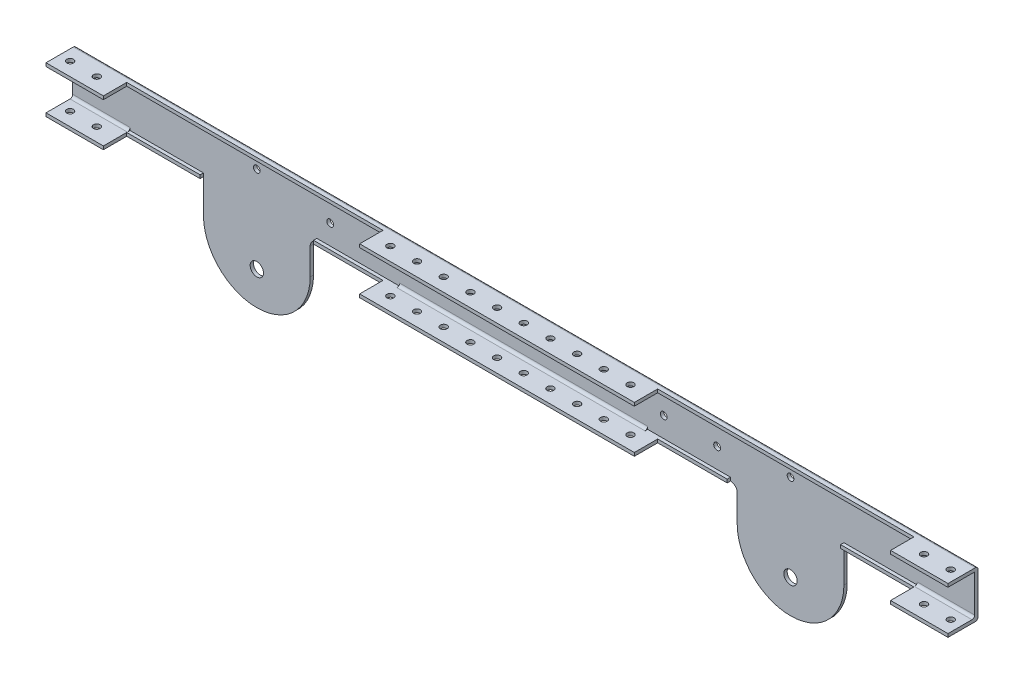
from build123d import *
from build123d.topology import SkipClean

# Parameters (mm, degrees)
SKETCH1_R            = 6.35
BOSS_EXTRUDE1_DEPTH  = 3.175
SKETCH2_W            = 596.9
SKETCH2_H            = 3.175
BOSS_EXTRUDE2_DEPTH  = 25.4
FILLET1_R            = 2.54
SKETCH3_R            = 3.2639
CUT_EXTRUDE1_DEPTH   = 25.4
SKETCH5_R            = 3.2639
CUT_EXTRUDE2_DEPTH   = 25.4
SKETCH6_W            = 31.75
SKETCH6_H            = 44.45
BOSS_EXTRUDE3_DEPTH  = 3.175
SKETCH7_W            = 31.75
SKETCH7_H            = 3.175
SKETCH7_W_2          = 381
BOSS_EXTRUDE4_DEPTH  = 25.4
FILLET2_R            = 2.54
SKETCH8_R            = 3.2639
CUT_EXTRUDE3_DEPTH   = 177.8
SKETCH9_R            = 3.2639
CUT_EXTRUDE5_DEPTH   = 432.308
BOSS_EXTRUDE6_DEPTH  = 66.675
BOSS_EXTRUDE7_START  = 66.675
BOSS_EXTRUDE7_DEPTH  = 66.675
SKETCH12_R           = 6.35
SKETCH12_R_2         = 3.2639
SKETCH12_W           = 256.6289
SKETCH12_H           = 252.715944366
CUT_EXTRUDE8_DEPTH   = 66.675
BOSS_EXTRUDE8_START  = 19.05
BOSS_EXTRUDE8_DEPTH  = 19.05
BOSS_EXTRUDE9_DEPTH  = 19.05
SKETCH16_R           = 3.2639
CUT_EXTRUDE9_DEPTH   = 133.096
SKETCH17_R           = 3.175
CUT_EXTRUDE11_DEPTH  = 5.08
SKETCH18_W           = 256.6289
SKETCH18_H           = 3.175
SKETCH18_W_2         = 838.2
BOSS_EXTRUDE10_DEPTH = 3.175
SKETCH19_W           = 107.950440108
SKETCH19_H           = 6.388661832
SKETCH19_W_2         = 107.95
SKETCH19_H_2         = 3.175
CUT_EXTRUDE12_DEPTH  = 3.175
SKETCH20_W           = 555.272296498
SKETCH20_H           = 244.428342312
SKETCH20_R           = 3.2639
SKETCH20_R_2         = 6.35
SKETCH20_R_3         = 3.175
CUT_EXTRUDE13_DEPTH  = 277.622
BOSS_EXTRUDE11_START = -3.175
SKETCH21_R           = 6.35
BOSS_EXTRUDE11_DEPTH = 3.175
SKETCH22_W           = 47.625
SKETCH22_H           = 22.225
SKETCH22_W_2         = 236.0422
BOSS_EXTRUDE12_DEPTH = 3.175
SKETCH23_W           = 47.625
SKETCH23_H           = 22.225
SKETCH23_W_2         = 236.0422
BOSS_EXTRUDE14_DEPTH = 3.175
BOSS_EXTRUDE15_DEPTH = 12.7
BOSS_EXTRUDE16_START = 12.7
BOSS_EXTRUDE16_DEPTH = 12.7
SKETCH27_R           = 3.175
CUT_EXTRUDE15_DEPTH  = 76.2
SKETCH28_W           = 22.225
SKETCH28_H           = 3.175
BOSS_EXTRUDE17_DEPTH = 12.7
SKETCH29_W           = 22.225
SKETCH29_H           = 3.175
BOSS_EXTRUDE18_DEPTH = 12.7
SKETCH30_R           = 6.321493949
BOSS_EXTRUDE19_DEPTH = 3.175
SKETCH31_R           = 6.35
CUT_EXTRUDE16_DEPTH  = 3.175
SKETCH32_W           = 28.574777667
SKETCH32_H           = 18.699670679
BOSS_EXTRUDE20_DEPTH = 3.175
CUT_EXTRUDE17_START  = -5.715
CUT_EXTRUDE17_DEPTH  = 5.715
CUT_EXTRUDE18_DEPTH  = 5.715


with BuildPart() as part:
    # Sketch1 → Boss-Extrude1 (new body)
    with BuildSketch(Plane.XY):
        with BuildLine():
            Line((50.8, 0), (50.8, 25.4))
            ThreePointArc((50.8, 25.4), (52.659871939, 29.890128061), (57.15, 31.75))
            Line((57.15, 31.75), (438.15, 31.75))
            ThreePointArc((438.15, 31.75), (442.640128061, 29.890128061), (444.5, 25.4))
            Line((444.5, 25.4), (444.5, 0))
            ThreePointArc((444.5, 0), (495.3, -50.8), (546.1, 0))
            Line((546.1, 0), (546.1, 76.2))
            Line((546.1, 76.2), (-50.8, 76.2))
            Line((-50.8, 76.2), (-50.8, 0))
            ThreePointArc((-50.8, 0), (0, -50.8), (50.8, 0))
        make_face()
        Circle(SKETCH1_R, mode=Mode.SUBTRACT)
        with Locations((495.3, 0)):
            Circle(SKETCH1_R, mode=Mode.SUBTRACT)
    extrude(amount=BOSS_EXTRUDE1_DEPTH)

    # Sketch2 → Boss-Extrude2 (add)
    with BuildSketch(Plane.XY.offset(3.175)):
        with Locations((247.65, 74.6125)):
            Rectangle(SKETCH2_W, SKETCH2_H)
    extrude(amount=BOSS_EXTRUDE2_DEPTH)

    # Fillet1
    fillet1_edges = [part.edges().sort_by_distance(p)[0] for p in [
        (247.65, 73.025, 3.175),
        (247.65, 76.2, 0),
    ]]
    fillet(fillet1_edges, radius=FILLET1_R)

    # Sketch3 → Cut-Extrude1 (cut)
    with BuildSketch(Plane(origin=(0, 76.2, 0), x_dir=(1, 0, 0), z_dir=(0, 1, 0))):
        with Locations((527.05, -15.5575)):
            Circle(SKETCH3_R)
        with Locations((501.65, -15.5575)):
            Circle(SKETCH3_R)
        with Locations((476.25, -15.5575)):
            Circle(SKETCH3_R)
        with Locations((450.85, -15.5575)):
            Circle(SKETCH3_R)
        with Locations((425.45, -15.5575)):
            Circle(SKETCH3_R)
        with Locations((400.05, -15.5575)):
            Circle(SKETCH3_R)
        with Locations((374.65, -15.5575)):
            Circle(SKETCH3_R)
        with Locations((349.25, -15.5575)):
            Circle(SKETCH3_R)
        with Locations((323.85, -15.5575)):
            Circle(SKETCH3_R)
        with Locations((298.45, -15.5575)):
            Circle(SKETCH3_R)
        with Locations((273.05, -15.5575)):
            Circle(SKETCH3_R)
        with Locations((247.65, -15.5575)):
            Circle(SKETCH3_R)
        with Locations((222.25, -15.5575)):
            Circle(SKETCH3_R)
        with Locations((196.85, -15.5575)):
            Circle(SKETCH3_R)
        with Locations((171.45, -15.5575)):
            Circle(SKETCH3_R)
        with Locations((146.05, -15.5575)):
            Circle(SKETCH3_R)
        with Locations((120.65, -15.5575)):
            Circle(SKETCH3_R)
        with Locations((95.25, -15.5575)):
            Circle(SKETCH3_R)
        with Locations((69.85, -15.5575)):
            Circle(SKETCH3_R)
        with Locations((44.45, -15.5575)):
            Circle(SKETCH3_R)
        with Locations((19.05, -15.5575)):
            Circle(SKETCH3_R)
        with Locations((-6.35, -15.5575)):
            Circle(SKETCH3_R)
        with Locations((-31.75, -15.5575)):
            Circle(SKETCH3_R)
    extrude(amount=-CUT_EXTRUDE1_DEPTH, mode=Mode.SUBTRACT)

    # Sketch5 → Cut-Extrude2 (cut)
    with BuildSketch(Plane(origin=(0, 0, 0), x_dir=(-1, 0, 0), z_dir=(0, 0, -1))):
        with Locations((-425.45, 53.975)):
            Circle(SKETCH5_R)
        with Locations((-374.65, 53.975)):
            Circle(SKETCH5_R)
        with Locations((-323.85, 53.975)):
            Circle(SKETCH5_R)
        with Locations((-273.05, 53.975)):
            Circle(SKETCH5_R)
        with Locations((-222.25, 53.975)):
            Circle(SKETCH5_R)
        with Locations((-171.45, 53.975)):
            Circle(SKETCH5_R)
        with Locations((-120.65, 53.975)):
            Circle(SKETCH5_R)
        with Locations((-69.85, 53.975)):
            Circle(SKETCH5_R)
    extrude(amount=-CUT_EXTRUDE2_DEPTH, mode=Mode.SUBTRACT)

    # Sketch6 → Boss-Extrude3 (add)
    with BuildSketch(Plane.XY.offset(3.175)):
        with Locations((-66.675, 53.975)):
            Rectangle(SKETCH6_W, SKETCH6_H)
        with Locations((561.975, 53.975)):
            Rectangle(SKETCH6_W, SKETCH6_H)
    extrude(amount=-BOSS_EXTRUDE3_DEPTH)

    # Sketch7 → Boss-Extrude4 (add)
    with BuildSketch(Plane.XY.offset(3.175)):
        with Locations((-66.675, 74.6125)):
            Rectangle(SKETCH7_W, SKETCH7_H)
        with Locations((-66.675, 33.3375)):
            Rectangle(SKETCH7_W, SKETCH7_H)
        with Locations((561.975, 74.6125)):
            Rectangle(SKETCH7_W, SKETCH7_H)
        with Locations((561.975, 33.3375)):
            Rectangle(SKETCH7_W, SKETCH7_H)
        with Locations((247.65, 33.3375)):
            Rectangle(SKETCH7_W_2, SKETCH7_H)
    extrude(amount=BOSS_EXTRUDE4_DEPTH)

    # Fillet2
    fillet2_edges = [part.edges().sort_by_distance(p)[0] for p in [
        (-50.8, 15.875, 0),
        (0, -50.8, 0),
        (50.8, 12.7, 0),
        (52.659871939, 29.890128061, 0),
        (546.1, 15.875, 0),
        (495.3, -50.8, 0),
        (444.5, 12.7, 0),
        (442.640128061, 29.890128061, 0),
        (-66.675, 34.925, 3.175),
        (-66.675, 31.75, 0),
        (247.65, 31.75, 0),
        (247.65, 34.925, 3.175),
        (561.975, 34.925, 3.175),
        (561.975, 31.75, 0),
        (561.975, 76.2, 0),
        (-66.675, 76.2, 0),
    ]]
    fillet(fillet2_edges, radius=FILLET2_R)

    # Sketch8 → Cut-Extrude3 (cut)
    with BuildSketch(Plane(origin=(0, 76.2, 0), x_dir=(1, 0, 0), z_dir=(0, 1, 0))):
        with Locations((-31.75, -15.5575)):
            Circle(SKETCH8_R)
        with Locations((-57.15, -15.5575)):
            Circle(SKETCH8_R)
        with Locations((-6.35, -15.5575)):
            Circle(SKETCH8_R)
        with Locations((19.05, -15.5575)):
            Circle(SKETCH8_R)
        with Locations((44.45, -15.5575)):
            Circle(SKETCH8_R)
        with Locations((69.85, -15.5575)):
            Circle(SKETCH8_R)
        with Locations((95.25, -15.5575)):
            Circle(SKETCH8_R)
        with Locations((120.65, -15.5575)):
            Circle(SKETCH8_R)
        with Locations((146.05, -15.5575)):
            Circle(SKETCH8_R)
        with Locations((171.45, -15.5575)):
            Circle(SKETCH8_R)
        with Locations((196.85, -15.5575)):
            Circle(SKETCH8_R)
        with Locations((222.25, -15.5575)):
            Circle(SKETCH8_R)
        with Locations((247.65, -15.5575)):
            Circle(SKETCH8_R)
        with Locations((273.05, -15.5575)):
            Circle(SKETCH8_R)
        with Locations((298.45, -15.5575)):
            Circle(SKETCH8_R)
        with Locations((323.85, -15.5575)):
            Circle(SKETCH8_R)
        with Locations((349.25, -15.5575)):
            Circle(SKETCH8_R)
        with Locations((374.65, -15.5575)):
            Circle(SKETCH8_R)
        with Locations((400.05, -15.5575)):
            Circle(SKETCH8_R)
        with Locations((425.45, -15.5575)):
            Circle(SKETCH8_R)
        with Locations((450.85, -15.5575)):
            Circle(SKETCH8_R)
        with Locations((476.25, -15.5575)):
            Circle(SKETCH8_R)
        with Locations((501.65, -15.5575)):
            Circle(SKETCH8_R)
        with Locations((527.05, -15.5575)):
            Circle(SKETCH8_R)
        with Locations((552.45, -15.5575)):
            Circle(SKETCH8_R)
    extrude(amount=-CUT_EXTRUDE3_DEPTH, mode=Mode.SUBTRACT)

    # Sketch9 → Cut-Extrude5 (cut)
    with BuildSketch(Plane(origin=(0, 76.2, 0), x_dir=(1, 0, 0), z_dir=(0, 1, 0))):
        with BuildLine():
            Line((298.45, -18.8214), (298.45, -28.575))
            Line((298.45, -28.575), (746.392900795, -28.575))
            Line((746.392900795, -28.575), (746.392900795, 89.004110939))
            Line((746.392900795, 89.004110939), (298.45, 89.004110939))
            Line((298.45, 89.004110939), (298.45, -12.2936))
            ThreePointArc((298.45, -12.2936), (301.7139, -15.5575), (298.45, -18.8214))
        make_face()
        with Locations((323.85, -15.5575)):
            Circle(SKETCH9_R, mode=Mode.SUBTRACT)
        with Locations((349.25, -15.5575)):
            Circle(SKETCH9_R, mode=Mode.SUBTRACT)
        with Locations((374.65, -15.5575)):
            Circle(SKETCH9_R, mode=Mode.SUBTRACT)
        with Locations((400.05, -15.5575)):
            Circle(SKETCH9_R, mode=Mode.SUBTRACT)
        with Locations((425.45, -15.5575)):
            Circle(SKETCH9_R, mode=Mode.SUBTRACT)
        with Locations((450.85, -15.5575)):
            Circle(SKETCH9_R, mode=Mode.SUBTRACT)
        with Locations((476.25, -15.5575)):
            Circle(SKETCH9_R, mode=Mode.SUBTRACT)
        with Locations((501.65, -15.5575)):
            Circle(SKETCH9_R, mode=Mode.SUBTRACT)
        with Locations((527.05, -15.5575)):
            Circle(SKETCH9_R, mode=Mode.SUBTRACT)
        with Locations((552.45, -15.5575)):
            Circle(SKETCH9_R, mode=Mode.SUBTRACT)
    extrude(amount=-CUT_EXTRUDE5_DEPTH, mode=Mode.SUBTRACT)

    # Mirror4: part across plane


with BuildPart() as part_1:
    with SkipClean():  # the faces are left unmerged after this step: merging them gives an invalid solid
        add(part.part)
        add(part.part.mirror(Plane(origin=(298.45, -356.108, 0), x_dir=(0, 0, 1), z_dir=(1, 0, 0))))

    # Sketch10 → Boss-Extrude6 (add)
    with SkipClean():  # the faces are left unmerged after this step: merging them gives an invalid solid
        with BuildSketch(Plane.ZY.offset(82.55)):
            with BuildLine():
                Line((0, 73.66), (0, 34.29))
                ThreePointArc((0, 34.29), (0.743948776, 32.493948776), (2.54, 31.75))
                Line((2.54, 31.75), (28.575, 31.75))
                Line((28.575, 31.75), (28.575, 34.925))
                Line((28.575, 34.925), (5.715, 34.925))
                ThreePointArc((5.715, 34.925), (3.918948776, 35.668948776), (3.175, 37.465))
                Line((3.175, 37.465), (3.175, 73.025))
                Line((3.175, 73.025), (28.575, 73.025))
                Line((28.575, 73.025), (28.575, 76.2))
                Line((28.575, 76.2), (2.54, 76.2))
                ThreePointArc((2.54, 76.2), (0.743948776, 75.456051224), (0, 73.66))
            make_face()
        extrude(amount=BOSS_EXTRUDE6_DEPTH)

    # Sketch11 → Boss-Extrude7 (add)
    with SkipClean():  # the faces are left unmerged after this step: merging them gives an invalid solid
        with BuildSketch(Plane(origin=(679.45, 0, 0), x_dir=(0, 0, -1), z_dir=(1, 0, 0)).offset(BOSS_EXTRUDE7_START)):
            with BuildLine():
                Line((0, 34.29), (0, 73.66))
                ThreePointArc((0, 73.66), (-0.743948776, 75.456051224), (-2.54, 76.2))
                Line((-2.54, 76.2), (-28.575, 76.2))
                Line((-28.575, 76.2), (-28.575, 73.025))
                Line((-28.575, 73.025), (-3.175, 73.025))
                Line((-3.175, 73.025), (-3.175, 37.465))
                ThreePointArc((-3.175, 37.465), (-3.918948776, 35.668948776), (-5.715, 34.925))
                Line((-5.715, 34.925), (-28.575, 34.925))
                Line((-28.575, 34.925), (-28.575, 31.75))
                Line((-28.575, 31.75), (-2.54, 31.75))
                ThreePointArc((-2.54, 31.75), (-0.743948776, 32.493948776), (0, 34.29))
            make_face()
        extrude(amount=-BOSS_EXTRUDE7_DEPTH)

    # Sketch12 → Cut-Extrude8 (cut)
    # profile 1 of 2: a face of its own
    with SkipClean():  # the faces are left unmerged after this step: merging them gives an invalid solid
        with BuildSketch(Plane.XY.offset(3.175)):
            with BuildLine():
                Line((135.9789, 114.3), (-120.65, 114.3))
                Line((-120.65, 114.3), (-120.65, -7.986269461))
                Line((-120.65, -7.986269461), (-114.3, -7.986269461))
                Line((-114.3, -7.986269461), (-114.3, 0))
                ThreePointArc((-114.3, 0), (0, -114.3), (114.3, 0))
                Line((114.3, 0), (114.3, -15.458780647))
                Line((114.3, -15.458780647), (135.9789, -15.458780647))
                Line((135.9789, -15.458780647), (135.9789, 114.3))
            make_face()
            Circle(SKETCH12_R, mode=Mode.SUBTRACT)
            with Locations((69.85, 53.975)):
                Circle(SKETCH12_R_2, mode=Mode.SUBTRACT)
            with Locations((120.65, 53.975)):
                Circle(SKETCH12_R_2, mode=Mode.SUBTRACT)
        # profile 2 of 2: a face of its own
        with BuildSketch(Plane.XY.offset(3.175)):
            with Locations((589.23555, 8.748218221)):
                Rectangle(SKETCH12_W, SKETCH12_H)
            with Locations((596.9, 0)):
                Circle(SKETCH12_R, mode=Mode.SUBTRACT)
            with Locations((476.25, 53.975)):
                Circle(SKETCH12_R_2, mode=Mode.SUBTRACT)
            with Locations((527.05, 53.975)):
                Circle(SKETCH12_R_2, mode=Mode.SUBTRACT)
        extrude(amount=CUT_EXTRUDE8_DEPTH, mode=Mode.SUBTRACT)

    # Sketch14 → Boss-Extrude8 (add)
    with SkipClean():  # the faces are left unmerged after this step: merging them gives an invalid solid
        with BuildSketch(Plane(origin=(746.125, 0, 0), x_dir=(0, 0, -1), z_dir=(1, 0, 0)).offset(BOSS_EXTRUDE8_START)):
            with BuildLine():
                Line((0, 34.29), (0, 73.66))
                ThreePointArc((0, 73.66), (-0.743948776, 75.456051224), (-2.54, 76.2))
                Line((-2.54, 76.2), (-28.575, 76.2))
                Line((-28.575, 76.2), (-28.575, 73.025))
                Line((-28.575, 73.025), (-3.175, 73.025))
                Line((-3.175, 73.025), (-3.175, 37.465))
                ThreePointArc((-3.175, 37.465), (-3.918948776, 35.668948776), (-5.715, 34.925))
                Line((-5.715, 34.925), (-28.575, 34.925))
                Line((-28.575, 34.925), (-28.575, 31.75))
                Line((-28.575, 31.75), (-2.54, 31.75))
                ThreePointArc((-2.54, 31.75), (-0.743948776, 32.493948776), (0, 34.29))
            make_face()
        extrude(amount=-BOSS_EXTRUDE8_DEPTH)

    # Sketch15 → Boss-Extrude9 (add)
    with SkipClean():  # the faces are left unmerged after this step: merging them gives an invalid solid
        with BuildSketch(Plane.ZY.offset(149.225)):
            with BuildLine():
                Line((0, 73.66), (0, 34.29))
                ThreePointArc((0, 34.29), (0.743948776, 32.493948776), (2.54, 31.75))
                Line((2.54, 31.75), (28.575, 31.75))
                Line((28.575, 31.75), (28.575, 34.925))
                Line((28.575, 34.925), (5.715, 34.925))
                ThreePointArc((5.715, 34.925), (3.918948776, 35.668948776), (3.175, 37.465))
                Line((3.175, 37.465), (3.175, 73.025))
                Line((3.175, 73.025), (28.575, 73.025))
                Line((28.575, 73.025), (28.575, 76.2))
                Line((28.575, 76.2), (2.54, 76.2))
                ThreePointArc((2.54, 76.2), (0.743948776, 75.456051224), (0, 73.66))
            make_face()
        extrude(amount=BOSS_EXTRUDE9_DEPTH)

    # Sketch16 → Cut-Extrude9 (cut)
    with SkipClean():  # the faces are left unmerged after this step: merging them gives an invalid solid
        with BuildSketch(Plane(origin=(0, 76.2, 0), x_dir=(1, 0, 0), z_dir=(0, 1, 0))):
            with Locations((146.05, -15.5575)):
                Circle(SKETCH16_R)
            with Locations((171.45, -15.5575)):
                Circle(SKETCH16_R)
            with Locations((196.85, -15.5575)):
                Circle(SKETCH16_R)
            with Locations((222.25, -15.5575)):
                Circle(SKETCH16_R)
            with Locations((247.65, -15.5575)):
                Circle(SKETCH16_R)
            with Locations((273.05, -15.5575)):
                Circle(SKETCH16_R)
            with Locations((298.45, -15.5575)):
                Circle(SKETCH16_R)
            with Locations((323.85, -15.5575)):
                Circle(SKETCH16_R)
            with Locations((349.25, -15.5575)):
                Circle(SKETCH16_R)
            with Locations((374.65, -15.5575)):
                Circle(SKETCH16_R)
            with Locations((400.05, -15.5575)):
                Circle(SKETCH16_R)
            with Locations((425.45, -15.5575)):
                Circle(SKETCH16_R)
            with Locations((450.85, -15.5575)):
                Circle(SKETCH16_R)
            with Locations((476.25, -15.5575)):
                Circle(SKETCH16_R)
            with Locations((501.65, -15.5575)):
                Circle(SKETCH16_R)
            with Locations((527.05, -15.5575)):
                Circle(SKETCH16_R)
            with Locations((552.45, -15.5575)):
                Circle(SKETCH16_R)
            with Locations((577.85, -15.5575)):
                Circle(SKETCH16_R)
            with Locations((603.25, -15.5575)):
                Circle(SKETCH16_R)
            with Locations((628.65, -15.5575)):
                Circle(SKETCH16_R)
            with Locations((654.05, -15.5575)):
                Circle(SKETCH16_R)
            with Locations((679.45, -15.5575)):
                Circle(SKETCH16_R)
            with Locations((704.85, -15.5575)):
                Circle(SKETCH16_R)
            with Locations((730.25, -15.5575)):
                Circle(SKETCH16_R)
            with Locations((755.65, -15.5575)):
                Circle(SKETCH16_R)
            with Locations((120.65, -15.5575)):
                Circle(SKETCH16_R)
            with Locations((95.25, -15.5575)):
                Circle(SKETCH16_R)
            with Locations((69.85, -15.5575)):
                Circle(SKETCH16_R)
            with Locations((44.45, -15.5575)):
                Circle(SKETCH16_R)
            with Locations((19.05, -15.5575)):
                Circle(SKETCH16_R)
            with Locations((-6.35, -15.5575)):
                Circle(SKETCH16_R)
            with Locations((-31.75, -15.5575)):
                Circle(SKETCH16_R)
            with Locations((-57.15, -15.5575)):
                Circle(SKETCH16_R)
            with Locations((-82.55, -15.5575)):
                Circle(SKETCH16_R)
            with Locations((-107.95, -15.5575)):
                Circle(SKETCH16_R)
            with Locations((-133.35, -15.5575)):
                Circle(SKETCH16_R)
            with Locations((-158.75, -15.5575)):
                Circle(SKETCH16_R)
        extrude(amount=-CUT_EXTRUDE9_DEPTH, mode=Mode.SUBTRACT)

    # Sketch17 → Cut-Extrude11 (cut)
    with SkipClean():  # the faces are left unmerged after this step: merging them gives an invalid solid
        with BuildSketch(Plane(origin=(0, 0, 0), x_dir=(-1, 0, 0), z_dir=(0, 0, -1))):
            with Locations((0, 63.5)):
                Circle(SKETCH17_R)
            with Locations((-596.9, 63.5)):
                Circle(SKETCH17_R)
        extrude(amount=-CUT_EXTRUDE11_DEPTH, mode=Mode.SUBTRACT)

    # Sketch18 → Boss-Extrude10 (add)
    with SkipClean():  # the faces are left unmerged after this step: merging them gives an invalid solid
        with BuildSketch(Plane.XY.offset(3.175)):
            with Locations((7.66445, 74.6125)):
                Rectangle(SKETCH18_W, SKETCH18_H)
            with Locations((589.23555, 74.6125)):
                Rectangle(SKETCH18_W, SKETCH18_H)
            with Locations((298.45, 33.3375)):
                Rectangle(SKETCH18_W_2, SKETCH18_H)
        extrude(amount=BOSS_EXTRUDE10_DEPTH)

    # Sketch19 → Cut-Extrude12 (cut)
    with SkipClean():  # the faces are left unmerged after this step: merging them gives an invalid solid
        with BuildSketch(Plane.XY.offset(3.175)):
            with Locations((3.175220054, 34.944330916)):
                Rectangle(SKETCH19_W, SKETCH19_H)
            with Locations((593.725, 33.3375)):
                Rectangle(SKETCH19_W_2, SKETCH19_H_2)
        extrude(amount=CUT_EXTRUDE12_DEPTH, mode=Mode.SUBTRACT)

    # Sketch20 → Cut-Extrude13 (cut)
    with BuildSketch(Plane(origin=(0, 0, 0), x_dir=(-1, 0, 0), z_dir=(0, 0, -1))):
        with Locations((-65.263851751, 61.916295681)):
            Rectangle(SKETCH20_W, SKETCH20_H)
        with Locations((-323.85, 53.975)):
            Circle(SKETCH20_R, mode=Mode.SUBTRACT)
        with Locations((-273.05, 53.975)):
            Circle(SKETCH20_R, mode=Mode.SUBTRACT)
        with Locations((-222.25, 53.975)):
            Circle(SKETCH20_R, mode=Mode.SUBTRACT)
        with Locations((-171.45, 53.975)):
            Circle(SKETCH20_R, mode=Mode.SUBTRACT)
        with Locations((-120.65, 53.975)):
            Circle(SKETCH20_R, mode=Mode.SUBTRACT)
        with Locations((-69.85, 53.975)):
            Circle(SKETCH20_R, mode=Mode.SUBTRACT)
        Circle(SKETCH20_R_2, mode=Mode.SUBTRACT)
        with Locations((0, 63.5)):
            Circle(SKETCH20_R_3, mode=Mode.SUBTRACT)
    extrude(amount=-CUT_EXTRUDE13_DEPTH, mode=Mode.SUBTRACT)

    # Sketch21 → Boss-Extrude11 (add)
    with BuildSketch(Plane.XY.offset(3.175).offset(BOSS_EXTRUDE11_START)):
        with BuildLine():
            Line((546.1, 0), (546.1, 25.4))
            ThreePointArc((546.1, 25.4), (544.240128061, 29.890128061), (539.75, 31.75))
            Line((539.75, 31.75), (539.75, 34.925))
            Line((539.75, 34.925), (647.7, 34.925))
            Line((647.7, 34.925), (647.7, 31.75))
            Line((647.7, 31.75), (647.7, 0))
            ThreePointArc((647.7, 0), (596.9, -50.8), (546.1, 0))
        make_face()
        with Locations((596.9, 0)):
            Circle(SKETCH21_R, mode=Mode.SUBTRACT)
    extrude(amount=BOSS_EXTRUDE11_DEPTH)

    # Mirror5: part across plane


with BuildPart() as part_2:
    add(part_1.part)
    add(part_1.part.mirror(Plane(origin=(342.9, 0, 277.622), x_dir=(0, 0, 1), z_dir=(1, 0, 0))))

    # Sketch22 → Boss-Extrude12 (add)
    with BuildSketch(Plane(origin=(0, 76.2, 0), x_dir=(1, 0, 0), z_dir=(0, 1, 0))):
        with Locations((741.3625, -17.4625)):
            Rectangle(SKETCH22_W, SKETCH22_H)
        with Locations((342.9, -17.4625)):
            Rectangle(SKETCH22_W_2, SKETCH22_H)
        with Locations((-55.5625, -17.4625)):
            Rectangle(SKETCH22_W, SKETCH22_H)
    extrude(amount=-BOSS_EXTRUDE12_DEPTH)

    # Sketch23 → Boss-Extrude14 (add)
    with BuildSketch(Plane.XZ.offset(-31.75)):
        with Locations((-55.5625, 17.4625)):
            Rectangle(SKETCH23_W, SKETCH23_H)
        with Locations((342.9, 17.4625)):
            Rectangle(SKETCH23_W_2, SKETCH23_H)
        with Locations((741.3625, 17.4625)):
            Rectangle(SKETCH23_W, SKETCH23_H)
    extrude(amount=-BOSS_EXTRUDE14_DEPTH)

    # Sketch25 → Boss-Extrude15 (add)
    with BuildSketch(Plane.ZY.offset(79.375)):
        with BuildLine():
            Line((2.54, 31.75), (28.575, 31.75))
            Line((28.575, 31.75), (28.575, 34.925))
            Line((28.575, 34.925), (5.715, 34.925))
            ThreePointArc((5.715, 34.925), (3.918948776, 35.668948776), (3.175, 37.465))
            Line((3.175, 37.465), (3.175, 73.025))
            Line((3.175, 73.025), (28.575, 73.025))
            Line((28.575, 73.025), (28.575, 76.2))
            Line((28.575, 76.2), (2.54, 76.2))
            ThreePointArc((2.54, 76.2), (0.743948776, 75.456051224), (0, 73.66))
            Line((0, 73.66), (0, 34.29))
            ThreePointArc((0, 34.29), (0.743948776, 32.493948776), (2.54, 31.75))
        make_face()
    extrude(amount=BOSS_EXTRUDE15_DEPTH)

    # Sketch26 → Boss-Extrude16 (add)
    with BuildSketch(Plane(origin=(765.175, 0, 0), x_dir=(0, 0, -1), z_dir=(1, 0, 0)).offset(BOSS_EXTRUDE16_START)):
        with BuildLine():
            Line((-5.715, 34.925), (-28.575, 34.925))
            Line((-28.575, 34.925), (-28.575, 31.75))
            Line((-28.575, 31.75), (-2.54, 31.75))
            ThreePointArc((-2.54, 31.75), (-0.743948776, 32.493948776), (0, 34.29))
            Line((0, 34.29), (0, 73.66))
            ThreePointArc((0, 73.66), (-0.743948776, 75.456051224), (-2.54, 76.2))
            Line((-2.54, 76.2), (-28.575, 76.2))
            Line((-28.575, 76.2), (-28.575, 73.025))
            Line((-28.575, 73.025), (-3.175, 73.025))
            Line((-3.175, 73.025), (-3.175, 37.465))
            ThreePointArc((-3.175, 37.465), (-3.918948776, 35.668948776), (-5.715, 34.925))
        make_face()
    extrude(amount=-BOSS_EXTRUDE16_DEPTH)

    # Sketch27 → Cut-Extrude15 (cut)
    with BuildSketch(Plane(origin=(0, 76.2, 0), x_dir=(1, 0, 0), z_dir=(0, 1, 0))):
        with Locations((762, -15.788044632)):
            Circle(SKETCH27_R)
        with Locations((736.6, -15.788044632)):
            Circle(SKETCH27_R)
        with Locations((711.2, -15.788044632)):
            Circle(SKETCH27_R)
        with Locations((685.8, -15.788044632)):
            Circle(SKETCH27_R)
        with Locations((660.4, -15.788044632)):
            Circle(SKETCH27_R)
        with Locations((635, -15.788044632)):
            Circle(SKETCH27_R)
        with Locations((609.6, -15.788044632)):
            Circle(SKETCH27_R)
        with Locations((584.2, -15.788044632)):
            Circle(SKETCH27_R)
        with Locations((558.8, -15.788044632)):
            Circle(SKETCH27_R)
        with Locations((533.4, -15.788044632)):
            Circle(SKETCH27_R)
        with Locations((508, -15.788044632)):
            Circle(SKETCH27_R)
        with Locations((482.6, -15.788044632)):
            Circle(SKETCH27_R)
        with Locations((457.2, -15.788044632)):
            Circle(SKETCH27_R)
        with Locations((431.8, -15.788044632)):
            Circle(SKETCH27_R)
        with Locations((406.4, -15.788044632)):
            Circle(SKETCH27_R)
        with Locations((381, -15.788044632)):
            Circle(SKETCH27_R)
        with Locations((355.6, -15.788044632)):
            Circle(SKETCH27_R)
        with Locations((330.2, -15.788044632)):
            Circle(SKETCH27_R)
        with Locations((304.8, -15.788044632)):
            Circle(SKETCH27_R)
        with Locations((279.4, -15.788044632)):
            Circle(SKETCH27_R)
        with Locations((254, -15.788044632)):
            Circle(SKETCH27_R)
        with Locations((228.6, -15.788044632)):
            Circle(SKETCH27_R)
        with Locations((203.2, -15.788044632)):
            Circle(SKETCH27_R)
        with Locations((177.8, -15.788044632)):
            Circle(SKETCH27_R)
        with Locations((152.4, -15.788044632)):
            Circle(SKETCH27_R)
        with Locations((127, -15.788044632)):
            Circle(SKETCH27_R)
        with Locations((101.6, -15.788044632)):
            Circle(SKETCH27_R)
        with Locations((76.2, -15.788044632)):
            Circle(SKETCH27_R)
        with Locations((50.8, -15.788044632)):
            Circle(SKETCH27_R)
        with Locations((25.4, -15.788044632)):
            Circle(SKETCH27_R)
        with Locations((0, -15.788044632)):
            Circle(SKETCH27_R)
        with Locations((-25.4, -15.788044632)):
            Circle(SKETCH27_R)
        with Locations((-50.8, -15.788044632)):
            Circle(SKETCH27_R)
        with Locations((-76.2, -15.788044632)):
            Circle(SKETCH27_R)
    extrude(amount=-CUT_EXTRUDE15_DEPTH, mode=Mode.SUBTRACT)

    # Sketch28 → Boss-Extrude17 (add)
    with BuildSketch(Plane.ZY.offset(-224.8789)):
        with Locations((17.4625, 74.6125)):
            Rectangle(SKETCH28_W, SKETCH28_H)
        with Locations((17.4625, 33.3375)):
            Rectangle(SKETCH28_W, SKETCH28_H)
    extrude(amount=BOSS_EXTRUDE17_DEPTH)

    # Sketch29 → Boss-Extrude18 (add)
    with BuildSketch(Plane(origin=(460.9211, 0, 0), x_dir=(0, 0, -1), z_dir=(1, 0, 0))):
        with Locations((-17.4625, 74.6125)):
            Rectangle(SKETCH29_W, SKETCH29_H)
        with Locations((-17.4625, 33.3375)):
            Rectangle(SKETCH29_W, SKETCH29_H)
    extrude(amount=BOSS_EXTRUDE18_DEPTH)

    # Sketch30 → Boss-Extrude19 (add)
    with BuildSketch(Plane.XY.offset(3.175)):
        with Locations((87.64816817, -19.05)):
            Circle(SKETCH30_R)
        Polygon((71.867948908, 15.024467729), (76.689488805, -7.576500536), (114.056423003, -16.014195355), (104.111996966, 17.133891434), align=None)
    extrude(amount=-BOSS_EXTRUDE19_DEPTH)

    # Sketch31 → Cut-Extrude16 (cut)
    with BuildSketch(Plane.XY.offset(3.175)):
        with Locations((88.9, -19.05)):
            Circle(SKETCH31_R)
        with Locations((596.9, -19.05)):
            Circle(SKETCH31_R)
    extrude(amount=-CUT_EXTRUDE16_DEPTH, mode=Mode.SUBTRACT)

    # Sketch32 → Boss-Extrude20 (add)
    with BuildSketch(Plane.XY.offset(3.175)):
        with Locations((601.058442049, 1.748623875)):
            Rectangle(SKETCH32_W, SKETCH32_H)
    extrude(amount=-BOSS_EXTRUDE20_DEPTH)

    # Sketch33 → Cut-Extrude17 (cut)
    with BuildSketch(Plane.ZY.offset(92.075).offset(CUT_EXTRUDE17_START)):
        with BuildLine():
            Line((2.54, 31.75), (28.575, 31.75))
            Line((28.575, 31.75), (28.575, 34.925))
            Line((28.575, 34.925), (5.715, 34.925))
            ThreePointArc((5.715, 34.925), (3.918948776, 35.668948776), (3.175, 37.465))
            Line((3.175, 37.465), (3.175, 73.025))
            Line((3.175, 73.025), (28.575, 73.025))
            Line((28.575, 73.025), (28.575, 76.2))
            Line((28.575, 76.2), (2.54, 76.2))
            ThreePointArc((2.54, 76.2), (0.743948776, 75.456051224), (0, 73.66))
            Line((0, 73.66), (0, 34.29))
            ThreePointArc((0, 34.29), (0.743948776, 32.493948776), (2.54, 31.75))
        make_face()
    extrude(amount=CUT_EXTRUDE17_DEPTH, mode=Mode.SUBTRACT)

    # Sketch34 → Cut-Extrude18 (cut)
    with BuildSketch(Plane(origin=(777.875, 0, 0), x_dir=(0, 0, -1), z_dir=(1, 0, 0))):
        with BuildLine():
            Line((-5.715, 34.925), (-28.575, 34.925))
            Line((-28.575, 34.925), (-28.575, 31.75))
            Line((-28.575, 31.75), (-2.54, 31.75))
            ThreePointArc((-2.54, 31.75), (-0.743948776, 32.493948776), (0, 34.29))
            Line((0, 34.29), (0, 73.66))
            ThreePointArc((0, 73.66), (-0.743948776, 75.456051224), (-2.54, 76.2))
            Line((-2.54, 76.2), (-28.575, 76.2))
            Line((-28.575, 76.2), (-28.575, 73.025))
            Line((-28.575, 73.025), (-3.175, 73.025))
            Line((-3.175, 73.025), (-3.175, 37.465))
            ThreePointArc((-3.175, 37.465), (-3.918948776, 35.668948776), (-5.715, 34.925))
        make_face()
    extrude(amount=-CUT_EXTRUDE18_DEPTH, mode=Mode.SUBTRACT)


solid = part_2.part
